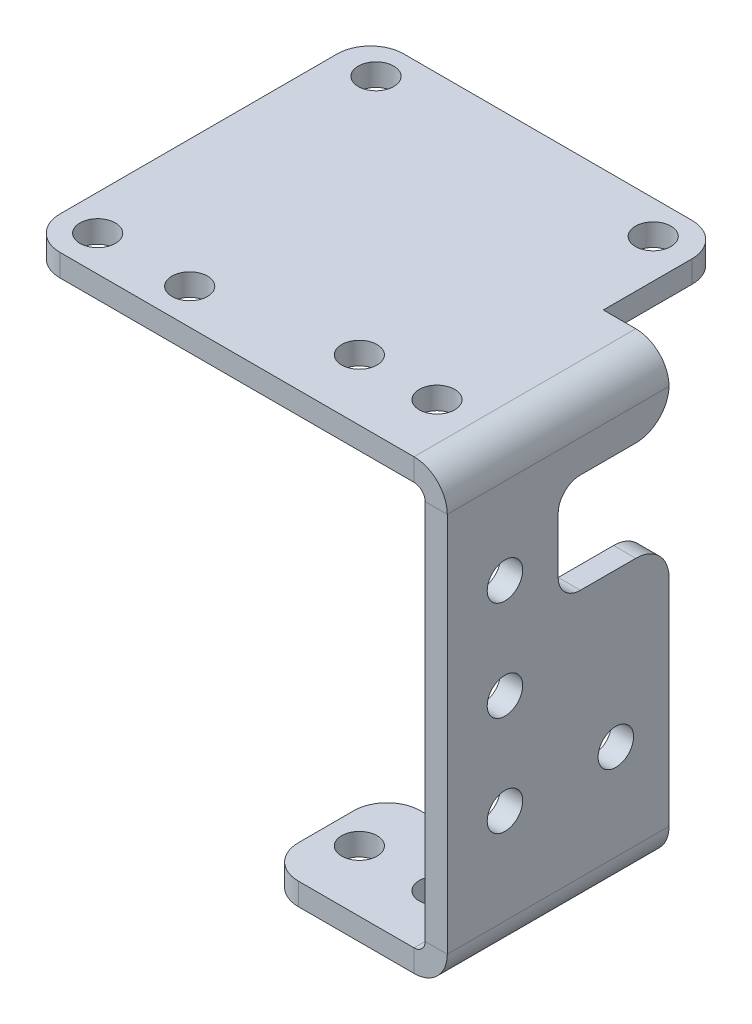
from build123d import *

# Parameters (mm, degrees)
SM_BASE_FLANGE_1_DEPTH = 2
OTHER_START            = -4.5
OTHER_3_DEPTH          = 20
OTHER_3_2_OUTLINE_W    = 2
OTHER_3_2_OUTLINE_H    = 24
OTHER_3_2_DEPTH        = 20
OTHER_START_2          = 5.5
OTHER_3_3_OUTLINE_W    = 2
OTHER_3_3_OUTLINE_H    = 15
OTHER_3_3_OUTLINE_H_2  = 9
OTHER_3_3_DEPTH        = 10
OTHER_START_3          = 4.5
OTHER_3_4_OUTLINE_W    = 2
OTHER_3_4_OUTLINE_H    = 15
OTHER_3_4_DEPTH        = 1
OTHER_4_DEPTH          = 20
OTHER_4_2_DEPTH        = 9
OTHER_4_3_DEPTH        = 11
OTHER_4_4_DEPTH        = 9
SKETCH_10_R            = 1.6
CUT_EXTRUDE_1_DEPTH    = 10
SKETCH_11_R            = 1.6
CUT_EXTRUDE_2_DEPTH    = 10
SKETCH_13_R            = 1.6
CUT_EXTRUDE_3_DEPTH    = 87
CUT_EXTRUDE_4_DEPTH    = 87
SKETCH_15_R            = 1.6
CUT_EXTRUDE_5_DEPTH    = 87
FILLET_1_R             = 3
FILLET_2_R             = 2


# Read off the part's stored shape, not the designer's step: 绘制的折弯3, 绘制的折弯4
# Sheet-metal steps are written as plain solids
with BuildPart() as part:
    # Sketch 1 → 基体-法兰1 (new body)
    with BuildSketch(Plane(origin=(0, 0, 0), x_dir=(1, 0, 0), z_dir=(0, 1, 0))):
        Polygon((-16, -15.5), (16, -15.5), (73, -15.5), (73, -4.5), (58, -4.5), (58, 4.5), (34, 4.5), (34, -5.5), (25, -5.5), (25, 4.5), (16, 4.5), (16, 15.5), (-16, 15.5), align=None)
    extrude(amount=-SM_BASE_FLANGE_1_DEPTH)

    # Other 3 outline → Other 3 (cut)
    with BuildSketch(Plane.XY.offset(OTHER_START)):
        with BuildLine():
            ThreePointArc((18.929203673, 0), (20.661254481, -0.550510257), (21.757630798, -2))
            Line((21.757630798, -2), (73, -2))
            Line((73, -2), (73, 0))
            Line((73, 0), (18.929203673, 0))
        make_face()
    extrude(amount=OTHER_3_DEPTH, mode=Mode.SUBTRACT)

    # Other 3 2 outline → Other 3 2 (add)
    with BuildSketch(Plane.XY.offset(OTHER_START)):
        with Locations((20.929203673, -26.929203673)):
            Rectangle(OTHER_3_2_OUTLINE_W, OTHER_3_2_OUTLINE_H)
        with BuildLine():
            Line((19.929203673, -3), (19.929203673, -5.929203673))
            Line((19.929203673, -5.929203673), (21.929203673, -5.929203673))
            Line((21.929203673, -5.929203673), (21.929203673, -3))
            ThreePointArc((21.929203673, -3), (21.885999352, -2.492694064), (21.757630798, -2))
            Line((21.757630798, -2), (18.929203673, -2))
            ThreePointArc((18.929203673, -2), (19.636310454, -2.292893219), (19.929203673, -3))
        make_face()
    extrude(amount=OTHER_3_2_DEPTH)

    # Other 3 3 outline → Other 3 3 (add)
    with BuildSketch(Plane.XY.offset(OTHER_START_2)):
        with Locations((20.929203673, -46.429203673)):
            Rectangle(OTHER_3_3_OUTLINE_W, OTHER_3_3_OUTLINE_H)
        with Locations((20.929203673, -10.429203673)):
            Rectangle(OTHER_3_3_OUTLINE_W, OTHER_3_3_OUTLINE_H_2)
    extrude(amount=OTHER_3_3_DEPTH)

    # Other 3 4 outline → Other 3 4 (add)
    with BuildSketch(Plane.XY.offset(OTHER_START_3)):
        with Locations((20.929203673, -46.429203673)):
            Rectangle(OTHER_3_4_OUTLINE_W, OTHER_3_4_OUTLINE_H)
    extrude(amount=OTHER_3_4_DEPTH)

    # Other 4 outline → Other 4 (cut)
    with BuildSketch(Plane.XY.offset(OTHER_START)):
        with BuildLine():
            Line((19.929203673, -40.186834471), (19.929203673, -53.929203673))
            Line((19.929203673, -53.929203673), (21.929203673, -53.929203673))
            Line((21.929203673, -53.929203673), (21.929203673, -37.358407346))
            ThreePointArc((21.929203673, -37.358407346), (21.378693416, -39.090458154), (19.929203673, -40.186834471))
        make_face()
    extrude(amount=OTHER_4_DEPTH, mode=Mode.SUBTRACT)

    # Other 4 2 outline → Other 4 2 (cut)
    with BuildSketch(Plane.XY.offset(OTHER_START)):
        Polygon((19.929203673, -38.929203673), (20.5, -38.929203673), (19.929203673, -38.358407347), align=None)
    extrude(amount=OTHER_4_2_DEPTH, mode=Mode.SUBTRACT)

    # Other 4 3 outline → Other 4 3 (add)
    with BuildSketch(Plane.XY.offset(OTHER_START_3)):
        with BuildLine():
            ThreePointArc((18.929203673, -40.358407346), (19.436509609, -40.315203025), (19.929203673, -40.186834471))
            Line((19.929203673, -40.186834471), (19.929203673, -37.358407346))
            ThreePointArc((19.929203673, -37.358407346), (19.636310454, -38.065514128), (18.929203673, -38.358407346))
            Line((18.929203673, -38.358407346), (5.5, -38.358407346))
            Line((5.5, -38.358407346), (5.5, -40.358407346))
            Line((5.5, -40.358407346), (18.929203673, -40.358407346))
        make_face()
    extrude(amount=OTHER_4_3_DEPTH)

    # Other 4 4 outline → Other 4 4 (add)
    with BuildSketch(Plane.XY.offset(OTHER_START)):
        with BuildLine():
            Line((20.5, -38.929203673), (21.050524017, -39.47972769))
            ThreePointArc((21.050524017, -39.47972769), (21.283955222, -39.217209419), (21.485098605, -38.929203673))
            Line((21.485098605, -38.929203673), (20.5, -38.929203673))
        make_face()
        with BuildLine():
            Line((19.636310454, -38.065514128), (19.929203673, -38.358407347))
            Line((19.929203673, -38.358407347), (19.929203673, -37.358407346))
            ThreePointArc((19.929203673, -37.358407346), (19.853083206, -37.741090779), (19.636310454, -38.065514128))
        make_face()
    extrude(amount=OTHER_4_4_DEPTH)

    # 草图10 → 切除-拉伸1 (cut)
    with BuildSketch(Plane(origin=(0, 0, 0), x_dir=(1, 0, 0), z_dir=(0, 1, 0))):
        with Locations(Location((-12.5, 12.5, 0), (0, 0, 270))):
            Circle(SKETCH_10_R)
        with Locations(Location((12.5, 12.5, 0), (0, 0, 270))):
            Circle(SKETCH_10_R)
    extrude(amount=-CUT_EXTRUDE_1_DEPTH, mode=Mode.SUBTRACT)

    # 草图11 → 切除-拉伸2 (cut)
    with BuildSketch(Plane(origin=(0, 0, 0), x_dir=(1, 0, 0), z_dir=(0, 1, 0))):
        with Locations(Location((-12.8, -12.3, 0), (0, 0, 270))):
            Circle(SKETCH_11_R)
        with Locations(Location((-4.5, -12.3, 0), (0, 0, 270))):
            Circle(SKETCH_11_R)
    extrude(amount=-CUT_EXTRUDE_2_DEPTH, mode=Mode.SUBTRACT)

    # 草图13 → 切除-拉伸3 (cut)
    with BuildSketch(Plane(origin=(0, -40.358407346, 0), x_dir=(-1, 0, 0), z_dir=(0, -1, 0))):
        with Locations(Location((-8.5, -10, 0), (0, 0, 180))):
            Circle(SKETCH_13_R)
        with Locations(Location((-15.5, -10, 0), (0, 0, 180))):
            Circle(SKETCH_13_R)
    extrude(amount=-CUT_EXTRUDE_3_DEPTH, mode=Mode.SUBTRACT)

    # 草图14 → 切除-拉伸4 (cut)
    with BuildSketch(Plane(origin=(21.929203673, 0, 0), x_dir=(0, 0, -1), z_dir=(1, 0, 0))):
        with BuildLine():
            Line((-10.3, -19.758407346), (-10.3, -20.179203673))
            Line((-10.3, -20.179203673), (-10.3, -21.358407346))
            ThreePointArc((-10.3, -21.358407346), (-9.16862915, -20.889778196), (-8.7, -19.758407346))
            ThreePointArc((-8.7, -19.758407346), (-9.16862915, -18.627036497), (-10.3, -18.158407346))
            Line((-10.3, -18.158407346), (-10.3, -19.758407346))
        make_face()
        with BuildLine():
            ThreePointArc((-10.3, -18.158407346), (-11.571470433, -18.78713862), (-11.843674335, -20.179203673))
            Line((-11.843674335, -20.179203673), (-10.3, -20.179203673))
            Line((-10.3, -20.179203673), (-10.3, -19.758407346))
            Line((-10.3, -19.758407346), (-10.3, -18.158407346))
        make_face()
        with BuildLine():
            Line((-10.3, -20.179203673), (-11.843674335, -20.179203673))
            ThreePointArc((-11.843674335, -20.179203673), (-11.271268726, -21.029877779), (-10.3, -21.358407346))
            Line((-10.3, -21.358407346), (-10.3, -20.179203673))
        make_face()
        with BuildLine():
            ThreePointArc((-8.7, -28.758407346), (-9.16862915, -27.627036497), (-10.3, -27.158407346))
            Line((-10.3, -27.158407346), (-10.3, -28.758407346))
            Line((-10.3, -28.758407346), (-10.3, -30.358407346))
            ThreePointArc((-10.3, -30.358407346), (-9.16862915, -29.889778196), (-8.7, -28.758407346))
        make_face()
        with BuildLine():
            Line((-10.3, -28.758407346), (-10.3, -27.158407346))
            ThreePointArc((-10.3, -27.158407346), (-11.9, -28.758407346), (-10.3, -30.358407346))
            Line((-10.3, -30.358407346), (-10.3, -28.758407346))
        make_face()
        with BuildLine():
            ThreePointArc((-8.7, -10.758407346), (-11.43137085, -9.627036497), (-10.3, -12.358407346))
            ThreePointArc((-10.3, -12.358407346), (-9.16862915, -11.889778196), (-8.7, -10.758407346))
        make_face()
    extrude(amount=-CUT_EXTRUDE_4_DEPTH, mode=Mode.SUBTRACT)

    # 草图15 → 切除-拉伸5 (cut)
    with BuildSketch(Plane(origin=(21.929203673, 0, 0), x_dir=(0, 0, -1), z_dir=(1, 0, 0))):
        with Locations(Location((-0.3, -28.758407346, 0), (0, 0, 90))):
            Circle(SKETCH_15_R)
    extrude(amount=-CUT_EXTRUDE_5_DEPTH, mode=Mode.SUBTRACT)

    # 圆角1
    fillet_1_edges = [part.edges().sort_by_distance(p)[0] for p in [
        (5.5, -39.358407346, 4.5),
        (5.5, -39.358407346, 15.5),
        (20.929203673, -5.929203673, -4.5),
        (20.929203673, -14.929203673, -4.5),
        (16, -1, -15.5),
        (-16, -1, -15.5),
        (-16, -1, 15.5),
    ]]
    fillet(fillet_1_edges, radius=FILLET_1_R)

    # 圆角2
    fillet_2_edges = [part.edges().sort_by_distance(p)[0] for p in [
        (20.929203673, -5.929203673, 5.5),
        (20.929203673, -14.929203673, 5.5),
    ]]
    fillet(fillet_2_edges, radius=FILLET_2_R)


solid = part.part
